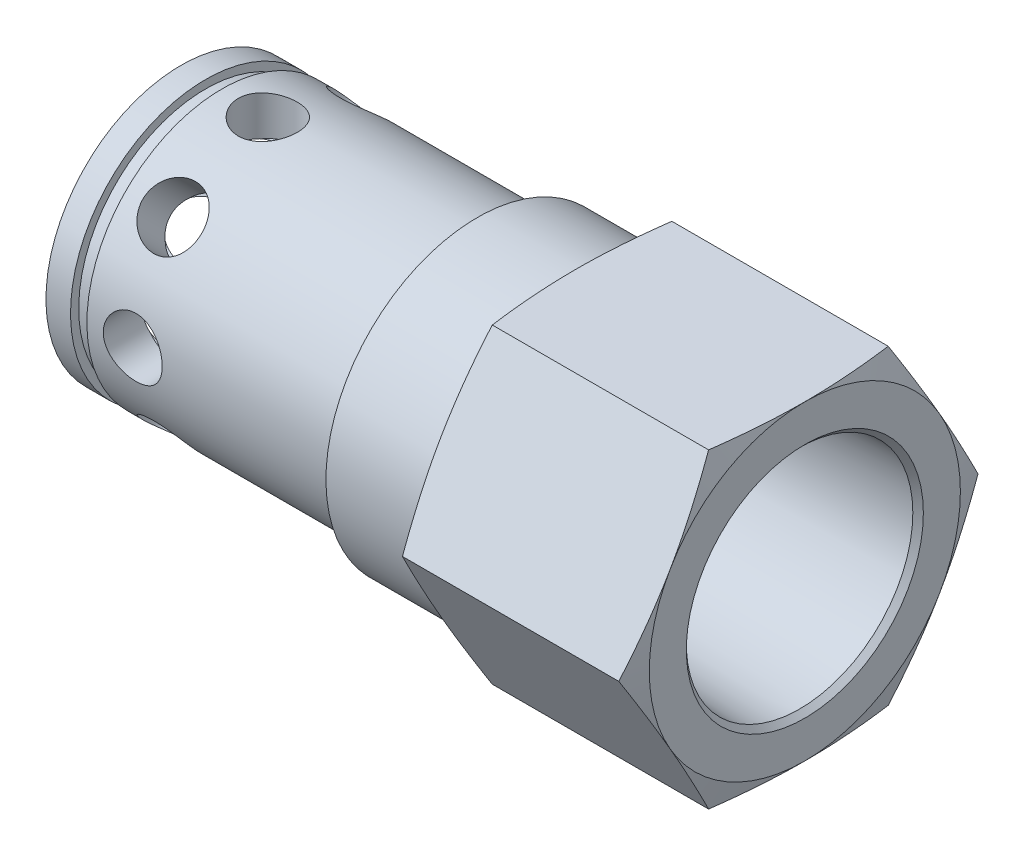
from build123d import *

# Parameters (mm, degrees)
SKETCH1_R           = 3
BOSS_EXTRUDE1_DEPTH = 38.1
FILLET1_R           = 0.2
CIRPATTERN1_COUNT   = 8


with BuildPart() as part:
    # Sketch1 → Boss-Extrude1 (new body)
    with BuildSketch(Plane(origin=(0, 0, 0), x_dir=(0, 0, -1), z_dir=(1, 0, 0))):
        Polygon((10.969655115, 0), (5.484827557, 9.5), (-5.484827557, 9.5), (-10.969655115, 0), (-5.484827557, -9.5), (5.484827557, -9.5), align=None)
        Circle(SKETCH1_R, mode=Mode.SUBTRACT)
    extrude(amount=BOSS_EXTRUDE1_DEPTH)

    # Sketch2 → Cut-Revolve1 (revolve, cut)
    with BuildSketch(Plane.XY):
        Polygon((24.1, 9.5), (24.1, 9.25), (18.1, 9.25), (18.1, 8.25), (2.5, 8.25), (2.5, 7.75), (1.5, 7.75), (1.5, 8.25), (0, 8.25), (0, 13), (25.037822174, 13), align=None)
        Polygon((38.1, 9.5), (38.1, 13), (37.162177826, 13), align=None)
    revolve(axis=Axis((0, 0, 0), (1, 0, 0)), mode=Mode.SUBTRACT)

    # Sketch3 → Cut-Revolve2 (revolve, cut)
    with BuildSketch(Plane.XY):
        Polygon((0, 5.85), (9.9, 5.85), (10.95, 4.8), (13, 4.8), (13, 6.25), (15.5, 6.25), (15.5, 4.8), (21.4, 4.8), (21.4, 0), (0, 0), align=None)
    revolve(axis=Axis((0, 0, 0), (1, 0, 0)), mode=Mode.SUBTRACT)

    # Fillet1
    fillet1_edges = [part.edges().sort_by_distance(p)[0] for p in [
        (15.5, -6.25, 0),
        (13, -6.25, 0),
    ]]
    fillet(fillet1_edges, radius=FILLET1_R)

    # Sketch4 → 1/4 NPT Tapped Hole1 (revolve, cut)
    with BuildSketch(Plane(origin=(38.1, 0, 0), x_dir=(0, 0, -1), z_dir=(0, 1, 0))):
        Polygon((0, 0), (0, 14.2), (5.5626, 14.2), (5.5626, 12), (6.56760783, 12), (6.9172709, 0.3217291), (7.239, 0), align=None)
    revolve(axis=Axis((44.45, 0, 0), (-1, 0, 0)), mode=Mode.SUBTRACT)

    # Sketch12 → Cut-Revolve3 (revolve, cut)
    with BuildSketch(Plane(origin=(0, 0, 0), x_dir=(1, 0, 0), z_dir=(0, 1, 0))):
        Polygon((5.3, 8.25), (5.3, 5.629827876), (6.9, 5.629827876), (7.1, 5.75), (7.1, 8.25), align=None)
    cut_revolve3 = revolve(axis=Axis((5.3, 0, -8.25), (0, 0, 1)), mode=Mode.SUBTRACT)

    # CirPattern1: Cut-Revolve3 ×8 about axis
    cirpattern1_axis = Axis((0, 0, 0), (-1, 0, 0))
    for i in range(1, CIRPATTERN1_COUNT):
        add(cut_revolve3.rotate(cirpattern1_axis, i * 360 / CIRPATTERN1_COUNT), mode=Mode.SUBTRACT)


solid = part.part
